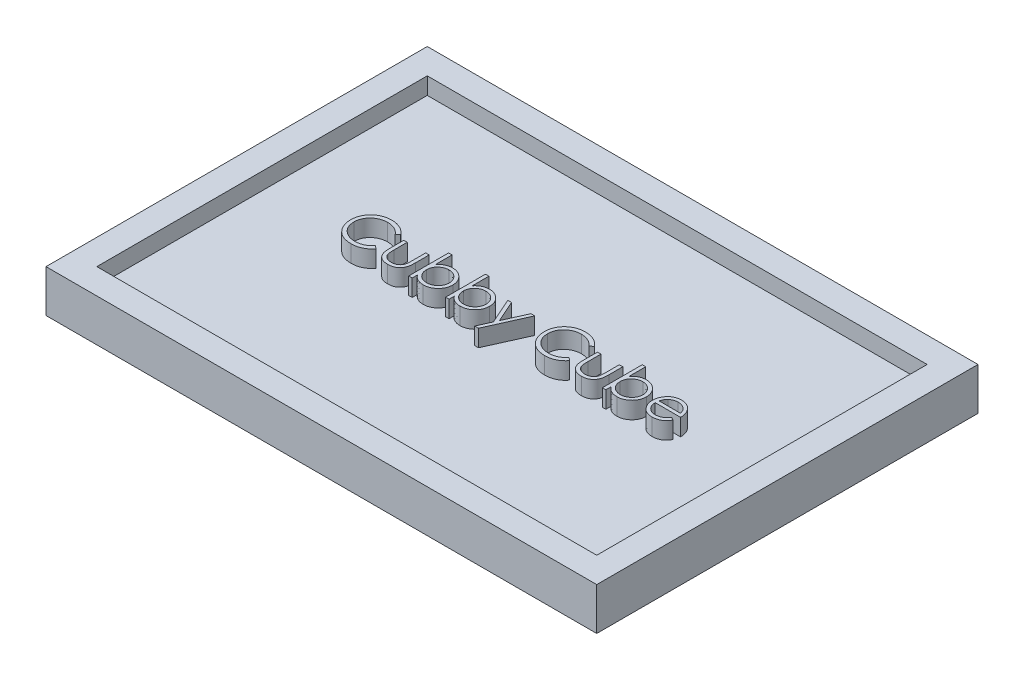
from build123d import *

# Parameters (mm, degrees)
SKETCH1_W           = 82.55
SKETCH1_H           = 57.15
BOSS_EXTRUDE1_DEPTH = 6.35
SHELL1_T            = -3.81
BOSS_EXTRUDE2_DEPTH = 2.54


with BuildPart() as part:
    # Sketch1 → Boss-Extrude1 (new body)
    with BuildSketch(Plane(origin=(0, 0, 0), x_dir=(1, 0, 0), z_dir=(0, 1, 0))):
        with Locations((41.275, 28.575)):
            Rectangle(SKETCH1_W, SKETCH1_H)
    extrude(amount=BOSS_EXTRUDE1_DEPTH)

    # Shell1
    shell1_openings = [part.faces().sort_by_distance(p)[0] for p in [
        (41.275, 6.35, -28.575),
    ]]
    offset(amount=SHELL1_T, openings=shell1_openings, kind=Kind.INTERSECTION)

    # Sketch2 → Boss-Extrude2 (add)
    # profile 1 of 9: a face of its own
    with BuildSketch(Plane(origin=(0, 3.81, 0), x_dir=(1, 0, 0), z_dir=(0, 1, 0))):
        with BuildLine():
            Line((22.421777935, 30.73376706), (21.964693267, 30.383957364))
            add(Edge.make_bspline(
                [(21.964693267, 30.383957364), (21.932086807, 30.422817197), (21.867313494, 30.500012949), (21.763105272, 30.608412739), (21.654502421, 30.709970084), (21.541546454, 30.805168782), (21.422204204, 30.89067976), (21.299366661, 30.970959201), (21.17097896, 31.04291757), (20.993440658, 31.130168513), (20.761192987, 31.221216582), (20.468829427, 31.297558028), (20.163632993, 31.346155626), (19.955417461, 31.351419059), (19.849510641, 31.354096253)],
                knots=[0, 0, 0, 0, 0.757959112, 1.505699292, 2.245454638, 2.979532153, 3.711538275, 4.438200793, 5.171680507, 5.909471876, 7.393775596, 8.890124382, 10.418191784, 12, 12, 12, 12], degree=3))
            add(Edge.make_bspline(
                [(19.849510641, 31.354096253), (19.791163773, 31.353424425), (19.675011551, 31.352087004), (19.502634268, 31.334443018), (19.333475777, 31.309644256), (19.167646112, 31.272847736), (19.005356359, 31.226326606), (18.845545542, 31.17073696), (18.690527438, 31.101959923), (18.538157582, 31.025942733), (18.392172394, 30.940081376), (18.25404394, 30.846426908), (18.124275998, 30.746027351), (18.002765916, 30.638506404), (17.889389473, 30.524348287), (17.784968195, 30.402336399), (17.689863412, 30.27286082), (17.602189978, 30.13762888), (17.523670706, 29.997034481), (17.457928752, 29.850557251), (17.3997119, 29.700705546), (17.353645422, 29.545786294), (17.317182862, 29.386889575), (17.292024117, 29.223588943), (17.274580791, 29.05622555), (17.273250021, 28.942786967), (17.272579217, 28.885605835)],
                knots=[0, 0, 0, 0, 1.054917814, 2.100044995, 3.131103042, 4.146048494, 5.169673617, 6.183595914, 7.203665975, 8.234915748, 9.262203917, 10.264457458, 11.251630812, 12.227803204, 13.197192746, 14.159520551, 15.12972552, 16.100847026, 17.073214652, 18.039054194, 19.002613845, 19.979014051, 20.95965708, 21.949030935, 22.966165397, 24, 24, 24, 24], degree=3))
            add(Edge.make_bspline(
                [(17.272579217, 28.885605835), (17.274677743, 28.799571723), (17.278797918, 28.630655156), (17.315466398, 28.383235462), (17.371188556, 28.146210009), (17.454701843, 27.921060438), (17.557679121, 27.705010466), (17.687800709, 27.501715611), (17.838504641, 27.308103777), (18.011922931, 27.128750684), (18.202190699, 26.964912976), (18.406332166, 26.820638497), (18.623838893, 26.700371961), (18.852309312, 26.600293631), (19.093501552, 26.523364287), (19.346981884, 26.469207048), (19.612199, 26.433879279), (19.79342549, 26.430497062), (19.885657643, 26.42877574)],
                knots=[0, 0, 0, 0, 1.029171465, 2.020641659, 2.987623507, 3.938342917, 4.889210282, 5.84687017, 6.821220943, 7.821438502, 8.827599549, 9.822697543, 10.807740252, 11.797342354, 12.80366471, 13.83203677, 14.896651826, 16, 16, 16, 16], degree=3))
            add(Edge.make_bspline(
                [(19.885657643, 26.42877574), (19.987277234, 26.431584342), (20.187288899, 26.437112341), (20.480605723, 26.483943855), (20.761395681, 26.55987732), (21.029673876, 26.666145651), (21.284683996, 26.804291135), (21.526825108, 26.971761296), (21.756301601, 27.170149154), (21.894290745, 27.321629071), (21.964693267, 27.398914629)],
                knots=[0, 0, 0, 0, 1.028121516, 2.023589091, 2.998037872, 3.967518031, 4.937445131, 5.927275754, 6.942489185, 8, 8, 8, 8], degree=3))
            Line((21.964693267, 27.398914629), (22.421777935, 27.05260303))
            add(Edge.make_bspline(
                [(22.421777935, 27.05260303), (22.384993412, 27.005140867), (22.311600561, 26.910443881), (22.192759074, 26.776944383), (22.067565759, 26.651373981), (21.935090727, 26.534745068), (21.796857923, 26.424723891), (21.65038528, 26.324436203), (21.49759833, 26.232482197), (21.33901475, 26.148284799), (21.174803033, 26.07358314), (21.005159943, 26.009630862), (20.830816712, 25.954541016), (20.65176537, 25.909218449), (20.467634522, 25.873842611), (20.279088627, 25.850193938), (20.085720751, 25.833992206), (19.955265197, 25.832515518), (19.88915574, 25.831767193)],
                knots=[0, 0, 0, 0, 0.986787822, 1.968848986, 2.935600012, 3.899624008, 4.868462664, 5.837806735, 6.815139263, 7.798259679, 8.787526145, 9.778297419, 10.776456485, 11.791383307, 12.812564526, 13.85620153, 14.913611965, 16, 16, 16, 16], degree=3))
            add(Edge.make_bspline(
                [(19.88915574, 25.831767193), (19.826550736, 25.832202912), (19.702757095, 25.833064491), (19.519985004, 25.847021465), (19.342051142, 25.866063468), (19.169464056, 25.894735448), (19.001281928, 25.928570023), (18.839029385, 25.97392472), (18.681109826, 26.024730893), (18.528157717, 26.084444306), (18.380042954, 26.151826576), (18.237243259, 26.2279823), (18.099824306, 26.312271067), (17.966435053, 26.402834936), (17.839045976, 26.502582901), (17.716553149, 26.610129673), (17.598269697, 26.725112769), (17.525089041, 26.808026139), (17.488295196, 26.849713407)],
                knots=[0, 0, 0, 0, 1.114604814, 2.203992996, 3.262667896, 4.300477797, 5.318619304, 6.316056647, 7.298880507, 8.271930387, 9.238335007, 10.195173496, 11.151986948, 12.108099108, 13.064862484, 14.031167946, 15.010108607, 16, 16, 16, 16], degree=3))
            add(Edge.make_bspline(
                [(17.488295196, 26.849713407), (17.429362346, 26.922126551), (17.312208135, 27.066078604), (17.16232054, 27.299387551), (17.034016809, 27.542978132), (16.930279712, 27.798130085), (16.849182642, 28.064270871), (16.793001298, 28.341534649), (16.756493689, 28.629662477), (16.75231884, 28.825636279), (16.750196739, 28.925250934)],
                knots=[0, 0, 0, 0, 0.994628077, 1.977248131, 2.950237994, 3.925870899, 4.908910175, 5.911660606, 6.938484602, 8, 8, 8, 8], degree=3))
            add(Edge.make_bspline(
                [(16.750196739, 28.925250934), (16.752783174, 29.029951849), (16.757871823, 29.235944363), (16.801105307, 29.538251759), (16.870653948, 29.827882121), (16.96943663, 30.104294777), (17.094676601, 30.368943588), (17.24938872, 30.619806878), (17.431775622, 30.858488984), (17.640406874, 31.081368279), (17.869194455, 31.285162892), (18.114199672, 31.464454877), (18.374942982, 31.61366365), (18.648551838, 31.738389411), (18.937075048, 31.834257643), (19.239897033, 31.901368836), (19.556448775, 31.943140992), (19.772422357, 31.948421665), (19.882159546, 31.9511048)],
                knots=[0, 0, 0, 0, 1.032925535, 2.032216505, 3.007276963, 3.968222605, 4.92396291, 5.891752235, 6.871517503, 7.883894988, 8.900124299, 9.891468569, 10.874487609, 11.85992873, 12.854644235, 13.869047385, 14.917252991, 16, 16, 16, 16], degree=3))
            add(Edge.make_bspline(
                [(19.882159546, 31.9511048), (19.949040043, 31.950302958), (20.081423251, 31.948715793), (20.277257126, 31.933238793), (20.467918234, 31.907438188), (20.653537927, 31.872320153), (20.83501923, 31.828734881), (21.010975107, 31.771956314), (21.182438042, 31.707034844), (21.34832665, 31.632264634), (21.507845008, 31.548333636), (21.660943433, 31.456172177), (21.806405823, 31.35589451), (21.945255729, 31.248353491), (22.075170428, 31.131273982), (22.199838506, 31.007876313), (22.315026275, 30.874606132), (22.38612891, 30.780799355), (22.421777935, 30.73376706)],
                knots=[0, 0, 0, 0, 1.096760587, 2.17092713, 3.219439832, 4.250915756, 5.268269357, 6.278326846, 7.281116186, 8.274029601, 9.260640565, 10.235837813, 11.203064059, 12.156899882, 13.114053108, 14.069676657, 15.032185724, 16, 16, 16, 16], degree=3))
        make_face()
    # profile 2 of 9: a face of its own
    with BuildSketch(Plane(origin=(0, 3.81, 0), x_dir=(1, 0, 0), z_dir=(0, 1, 0))):
        with BuildLine():
            Line((23.391916824, 30.234705227), (23.914299303, 30.234705227))
            Line((23.914299303, 30.234705227), (23.914299303, 28.261778545))
            add(Edge.make_bspline(
                [(23.914299303, 28.261778545), (23.914535304, 28.203864996), (23.914986764, 28.093079091), (23.918048424, 27.933662786), (23.925249782, 27.788280468), (23.934253488, 27.656848152), (23.945832183, 27.539388073), (23.959608201, 27.4363105), (23.975005837, 27.346446506), (23.990077994, 27.292323806), (23.997087597, 27.267152977)],
                knots=[0, 0, 0, 0, 1.388932606, 2.656963016, 3.823490214, 4.879454478, 5.816252168, 6.653371382, 7.373723809, 8, 8, 8, 8], degree=3))
            add(Edge.make_bspline(
                [(23.997087597, 27.267152977), (24.008332541, 27.235516131), (24.030588649, 27.172900161), (24.070957764, 27.082446065), (24.120897748, 26.998667173), (24.175546771, 26.9183329), (24.238577095, 26.843822929), (24.309191239, 26.775263085), (24.38502545, 26.710062948), (24.497708507, 26.632920621), (24.651809691, 26.550239293), (24.854129809, 26.478899461), (25.073499099, 26.436264651), (25.225114709, 26.431318182), (25.303043794, 26.42877574)],
                knots=[0, 0, 0, 0, 0.725840625, 1.436591201, 2.137033971, 2.831655856, 3.53531722, 4.242432219, 4.957935707, 5.694543706, 7.190802206, 8.724350549, 10.316345118, 12, 12, 12, 12], degree=3))
            add(Edge.make_bspline(
                [(25.303043794, 26.42877574), (25.38096564, 26.431372245), (25.531729993, 26.436396002), (25.748689031, 26.477613387), (25.947015491, 26.546474992), (26.124718799, 26.642614223), (26.28099294, 26.760265011), (26.411220646, 26.898316565), (26.518668664, 27.052401319), (26.565583617, 27.167361578), (26.589177441, 27.225175814)],
                knots=[0, 0, 0, 0, 1.157059328, 2.238695713, 3.266970494, 4.264342957, 5.228770407, 6.160125903, 7.074715775, 8, 8, 8, 8], degree=3))
            add(Edge.make_bspline(
                [(26.589177441, 27.225175814), (26.596152845, 27.248403098), (26.61157376, 27.299752952), (26.628142099, 27.386865462), (26.643067484, 27.490750049), (26.655812075, 27.612086498), (26.664901161, 27.750557724), (26.669800684, 27.906120453), (26.675335923, 28.078286335), (26.675419936, 28.19880712), (26.675463833, 28.261778545)],
                knots=[0, 0, 0, 0, 0.557542046, 1.232589297, 2.036731608, 2.971723315, 4.038036528, 5.22795436, 6.551621927, 8, 8, 8, 8], degree=3))
            Line((26.675463833, 28.261778545), (26.675463833, 30.234705227))
            Line((26.675463833, 30.234705227), (27.197846311, 30.234705227))
            Line((27.197846311, 30.234705227), (27.197846311, 28.16383183))
            add(Edge.make_bspline(
                [(27.197846311, 28.16383183), (27.197111731, 28.093470975), (27.195686544, 27.95696129), (27.186527307, 27.758580452), (27.170811702, 27.573707052), (27.14695845, 27.402243231), (27.118909227, 27.244319895), (27.082726473, 27.099734643), (27.03952219, 26.968932944), (26.990784327, 26.849619536), (26.933204864, 26.741440356), (26.871958022, 26.638767814), (26.801235276, 26.544149444), (26.726778113, 26.452875223), (26.643953216, 26.369485088), (26.554312618, 26.29206555), (26.459118011, 26.219433139), (26.356256904, 26.154420618), (26.247230928, 26.095851983), (26.13190549, 26.043936672), (26.008868044, 26.002853934), (25.879706019, 25.967412267), (25.743786602, 25.939614513), (25.601240824, 25.92001233), (25.452116702, 25.907995917), (25.35048585, 25.90693645), (25.298379665, 25.906393262)],
                knots=[0, 0, 0, 0, 1.493040784, 2.896703357, 4.213163133, 5.428574705, 6.569057535, 7.615249723, 8.588095153, 9.490268104, 10.346124644, 11.18633936, 12.024365274, 12.850166724, 13.684164916, 14.514361689, 15.362232829, 16.222528818, 17.093394965, 17.986930858, 18.902426812, 19.842810585, 20.827885679, 21.843828298, 22.894529745, 24, 24, 24, 24], degree=3))
            add(Edge.make_bspline(
                [(25.298379665, 25.906393262), (25.2466632, 25.906958227), (25.145035533, 25.908068436), (24.995903714, 25.919945943), (24.852962996, 25.939584055), (24.716721571, 25.967615887), (24.587042722, 26.002605864), (24.463401171, 26.044189125), (24.347244674, 26.095878926), (24.237177698, 26.154049935), (24.134061822, 26.219850756), (24.037421722, 26.291975936), (23.94738698, 26.370317806), (23.863937738, 26.454549184), (23.788245323, 26.54571497), (23.719366501, 26.643081812), (23.656240886, 26.745684957), (23.599108924, 26.855554288), (23.550028064, 26.976248452), (23.506695708, 27.109790172), (23.471254087, 27.257643524), (23.44241191, 27.419682101), (23.419209336, 27.595130402), (23.403100359, 27.78500335), (23.394093317, 27.988838443), (23.392657963, 28.129619272), (23.391916824, 28.202310896)],
                knots=[0, 0, 0, 0, 1.083640291, 2.129454052, 3.13281866, 4.105697902, 5.042300162, 5.946461698, 6.836384745, 7.703652036, 8.553297018, 9.397182691, 10.228592656, 11.052265423, 11.879314572, 12.708807002, 13.549817954, 14.402308542, 15.300838682, 16.27712199, 17.341985831, 18.484375296, 19.725102775, 21.0496083, 22.476576903, 24, 24, 24, 24], degree=3))
            Line((23.391916824, 28.202310896), (23.391916824, 30.234705227))
        make_face()
    # profile 3 of 9: a face of its own
    with BuildSketch(Plane(origin=(0, 3.81, 0), x_dir=(1, 0, 0), z_dir=(0, 1, 0))):
        with BuildLine():
            Line((28.391863405, 25.98101933), (28.391863405, 31.9511048))
            Line((28.391863405, 31.9511048), (28.914245884, 31.9511048))
            Line((28.914245884, 31.9511048), (28.914245884, 29.462791833))
            add(Edge.make_bspline(
                [(28.914245884, 29.462791833), (28.973108511, 29.530576155), (29.087951922, 29.662826162), (29.280499186, 29.835534694), (29.482408211, 29.98197435), (29.695214977, 30.102691978), (29.919222153, 30.194617251), (30.153273052, 30.261843535), (30.397965986, 30.302401277), (30.564806326, 30.30700152), (30.649301974, 30.309331296)],
                knots=[0, 0, 0, 0, 1.077089805, 2.101446609, 3.097517232, 4.067117542, 5.031729543, 5.997785507, 6.985986182, 8, 8, 8, 8], degree=3))
            add(Edge.make_bspline(
                [(30.649301974, 30.309331296), (30.724417562, 30.307268678), (30.872933883, 30.303190532), (31.091268597, 30.272199591), (31.301339603, 30.221944509), (31.503032556, 30.152273825), (31.695406328, 30.05983404), (31.880108117, 29.949169508), (32.056191626, 29.81738862), (32.220929334, 29.666715001), (32.372759762, 29.50313857), (32.505661877, 29.328213688), (32.6179203, 29.144483091), (32.710773057, 28.952561797), (32.78257063, 28.751665961), (32.832034853, 28.541992562), (32.863456483, 28.323747869), (32.867415059, 28.17521217), (32.869427508, 28.099700052)],
                knots=[0, 0, 0, 0, 1.034377878, 2.045141349, 3.03070803, 4.00595497, 4.978199603, 5.965204761, 6.967410914, 8.002051993, 9.036360596, 10.037508045, 11.022711142, 11.997267194, 12.969246472, 13.954813154, 14.960274251, 16, 16, 16, 16], degree=3))
            add(Edge.make_bspline(
                [(32.869427508, 28.099700052), (32.86737119, 28.025359666), (32.863316454, 27.878772131), (32.832347445, 27.663057775), (32.781213479, 27.455439129), (32.708101844, 27.256452682), (32.616190987, 27.065163612), (32.501252354, 26.883752511), (32.368519061, 26.709062691), (32.214963567, 26.546705294), (32.048797813, 26.396638556), (31.870989245, 26.266242135), (31.686016597, 26.153622116), (31.490996873, 26.064387996), (31.288817643, 25.99220813), (31.077312862, 25.942119542), (30.857679137, 25.912893878), (30.708468081, 25.908577203), (30.632977521, 25.906393262)],
                knots=[0, 0, 0, 0, 1.024244038, 2.01964794, 2.996620209, 3.965911562, 4.936179293, 5.91563013, 6.920572822, 7.955171681, 8.990768464, 10.002129126, 10.989675881, 11.969873457, 12.952483066, 13.943799762, 14.959703725, 16, 16, 16, 16], degree=3))
            add(Edge.make_bspline(
                [(30.632977521, 25.906393262), (30.546554591, 25.90878913), (30.377094292, 25.913487011), (30.129205515, 25.952435004), (29.894573461, 26.018728658), (29.670525348, 26.107806959), (29.460264004, 26.228429018), (29.262454488, 26.378035661), (29.078344236, 26.559092077), (28.969882461, 26.697231246), (28.914245884, 26.768091145)],
                knots=[0, 0, 0, 0, 1.035807596, 2.031038093, 2.998900396, 3.954262848, 4.914341711, 5.895762244, 6.92060972, 8, 8, 8, 8], degree=3))
            Line((28.914245884, 26.768091145), (28.914245884, 25.98101933))
            Line((28.914245884, 25.98101933), (28.391863405, 25.98101933))
        make_face()
        with BuildLine():
            add(Edge.make_bspline(
                [(30.628313392, 26.42877574), (30.704673333, 26.431492621), (30.855395711, 26.43685531), (31.076660205, 26.478721443), (31.288395861, 26.548378713), (31.489535725, 26.643646976), (31.676932152, 26.763426479), (31.844327069, 26.90835886), (31.993140347, 27.073839355), (32.117293361, 27.260494676), (32.220947841, 27.459153014), (32.292150397, 27.668128085), (32.339914028, 27.881827156), (32.344657672, 28.026759328), (32.347045029, 28.099700052)],
                knots=[0, 0, 0, 0, 1.031910345, 2.036826888, 3.032245421, 4.038315463, 5.03827337, 6.029480047, 7.023177075, 8.037597977, 9.052889626, 10.043399556, 11.015292101, 12, 12, 12, 12], degree=3))
            add(Edge.make_bspline(
                [(32.347045029, 28.099700052), (32.343905531, 28.172569472), (32.337639069, 28.318017396), (32.293775294, 28.53363714), (32.217176803, 28.742501321), (32.11553171, 28.944031857), (31.989356025, 29.131974591), (31.84133063, 29.300762338), (31.671891484, 29.446382931), (31.484255392, 29.567772371), (31.284384289, 29.66682558), (31.074018319, 29.734754747), (30.857552965, 29.779222899), (30.710542842, 29.784360414), (30.636475618, 29.786948817)],
                knots=[0, 0, 0, 0, 0.984795267, 1.965658976, 2.959410029, 3.983795688, 5.009594896, 6.01088574, 7.009236619, 8.019050059, 9.024672985, 10.014834719, 10.999826153, 12, 12, 12, 12], degree=3))
            add(Edge.make_bspline(
                [(30.636475618, 29.786948817), (30.560858823, 29.784361877), (30.410774828, 29.779227325), (30.189303392, 29.734676622), (29.972995764, 29.666410535), (29.766293762, 29.568402089), (29.573617434, 29.448473862), (29.401299792, 29.30754284), (29.252732904, 29.146588636), (29.130422609, 28.966133153), (29.033289866, 28.771243279), (28.963799513, 28.563336079), (28.92222272, 28.343505968), (28.916937183, 28.192774315), (28.914245884, 28.116024505)],
                knots=[0, 0, 0, 0, 1.016820015, 2.018181405, 3.029022337, 4.06341356, 5.088169224, 6.076823655, 7.05054209, 8.02560866, 9.001194327, 9.972267242, 10.967515442, 12, 12, 12, 12], degree=3))
            add(Edge.make_bspline(
                [(28.914245884, 28.116024505), (28.915841907, 28.057254347), (28.918983386, 27.941576079), (28.942982464, 27.771728003), (28.981159915, 27.609188563), (29.034950226, 27.453780636), (29.105633827, 27.306386426), (29.190801376, 27.165861398), (29.292169769, 27.033473564), (29.40676799, 26.90954749), (29.533100664, 26.796773976), (29.668681374, 26.69902019), (29.810739528, 26.614843971), (29.960900349, 26.547746656), (30.117416388, 26.492986716), (30.281893748, 26.456841427), (30.452646105, 26.431936511), (30.569141099, 26.429840424), (30.628313392, 26.42877574)],
                knots=[0, 0, 0, 0, 1.050331198, 2.067384183, 3.060053655, 4.031335885, 5.001026174, 5.976994447, 6.963687968, 7.976578778, 8.990422448, 9.985569286, 10.960374351, 11.936812464, 12.921228065, 13.919088064, 14.943024695, 16, 16, 16, 16], degree=3))
        make_face(mode=Mode.SUBTRACT)
    # profile 4 of 9: a face of its own
    with BuildSketch(Plane(origin=(0, 3.81, 0), x_dir=(1, 0, 0), z_dir=(0, 1, 0))):
        with BuildLine():
            Line((33.914192465, 25.98101933), (33.914192465, 31.9511048))
            Line((33.914192465, 31.9511048), (34.436574944, 31.9511048))
            Line((34.436574944, 31.9511048), (34.436574944, 29.462791833))
            add(Edge.make_bspline(
                [(34.436574944, 29.462791833), (34.49543757, 29.530576155), (34.610280981, 29.662826162), (34.802828246, 29.835534694), (35.004737271, 29.98197435), (35.217544037, 30.102691978), (35.441551212, 30.194617251), (35.675602112, 30.261843535), (35.920295045, 30.302401277), (36.087135386, 30.30700152), (36.171631034, 30.309331296)],
                knots=[0, 0, 0, 0, 1.077089805, 2.101446609, 3.097517232, 4.067117542, 5.031729543, 5.997785507, 6.985986182, 8, 8, 8, 8], degree=3))
            add(Edge.make_bspline(
                [(36.171631034, 30.309331296), (36.246746622, 30.307268678), (36.395262943, 30.303190532), (36.613597657, 30.272199591), (36.823668663, 30.221944509), (37.025361615, 30.152273825), (37.217735388, 30.05983404), (37.402437177, 29.949169508), (37.578520686, 29.81738862), (37.743258394, 29.666715001), (37.895088822, 29.50313857), (38.027990937, 29.328213688), (38.14024936, 29.144483091), (38.233102117, 28.952561797), (38.304899689, 28.751665961), (38.354363912, 28.541992562), (38.385785543, 28.323747869), (38.389744119, 28.17521217), (38.391756568, 28.099700052)],
                knots=[0, 0, 0, 0, 1.034377878, 2.045141349, 3.03070803, 4.00595497, 4.978199603, 5.965204761, 6.967410914, 8.002051993, 9.036360596, 10.037508045, 11.022711142, 11.997267194, 12.969246472, 13.954813154, 14.960274251, 16, 16, 16, 16], degree=3))
            add(Edge.make_bspline(
                [(38.391756568, 28.099700052), (38.389700249, 28.025359666), (38.385645514, 27.878772131), (38.354676505, 27.663057775), (38.303542538, 27.455439129), (38.230430904, 27.256452682), (38.138520047, 27.065163612), (38.023581414, 26.883752511), (37.890848121, 26.709062691), (37.737292627, 26.546705294), (37.571126873, 26.396638556), (37.393318305, 26.266242135), (37.208345657, 26.153622116), (37.013325933, 26.064387996), (36.811146703, 25.99220813), (36.599641922, 25.942119542), (36.380008196, 25.912893878), (36.23079714, 25.908577203), (36.155306581, 25.906393262)],
                knots=[0, 0, 0, 0, 1.024244038, 2.01964794, 2.996620209, 3.965911562, 4.936179293, 5.91563013, 6.920572822, 7.955171681, 8.990768464, 10.002129126, 10.989675881, 11.969873457, 12.952483066, 13.943799762, 14.959703725, 16, 16, 16, 16], degree=3))
            add(Edge.make_bspline(
                [(36.155306581, 25.906393262), (36.06888365, 25.90878913), (35.899423352, 25.913487011), (35.651534574, 25.952435004), (35.416902521, 26.018728658), (35.192854408, 26.107806959), (34.982593064, 26.228429018), (34.784783548, 26.378035661), (34.600673296, 26.559092077), (34.492211521, 26.697231246), (34.436574944, 26.768091145)],
                knots=[0, 0, 0, 0, 1.035807596, 2.031038093, 2.998900396, 3.954262848, 4.914341711, 5.895762244, 6.92060972, 8, 8, 8, 8], degree=3))
            Line((34.436574944, 26.768091145), (34.436574944, 25.98101933))
            Line((34.436574944, 25.98101933), (33.914192465, 25.98101933))
        make_face()
        with BuildLine():
            add(Edge.make_bspline(
                [(36.150642452, 26.42877574), (36.227002393, 26.431492621), (36.377724771, 26.43685531), (36.598989265, 26.478721443), (36.810724921, 26.548378713), (37.011864785, 26.643646976), (37.199261212, 26.763426479), (37.366656128, 26.90835886), (37.515469407, 27.073839355), (37.63962242, 27.260494676), (37.743276901, 27.459153014), (37.814479457, 27.668128085), (37.862243088, 27.881827156), (37.866986732, 28.026759328), (37.869374089, 28.099700052)],
                knots=[0, 0, 0, 0, 1.031910345, 2.036826888, 3.032245421, 4.038315463, 5.03827337, 6.029480047, 7.023177075, 8.037597977, 9.052889626, 10.043399556, 11.015292101, 12, 12, 12, 12], degree=3))
            add(Edge.make_bspline(
                [(37.869374089, 28.099700052), (37.866234591, 28.172569472), (37.859968129, 28.318017396), (37.816104354, 28.53363714), (37.739505863, 28.742501321), (37.637860769, 28.944031857), (37.511685084, 29.131974591), (37.36365969, 29.300762338), (37.194220544, 29.446382931), (37.006584452, 29.567772371), (36.806713349, 29.66682558), (36.596347379, 29.734754747), (36.379882025, 29.779222899), (36.232871902, 29.784360414), (36.158804678, 29.786948817)],
                knots=[0, 0, 0, 0, 0.984795267, 1.965658976, 2.959410029, 3.983795688, 5.009594896, 6.01088574, 7.009236619, 8.019050059, 9.024672985, 10.014834719, 10.999826153, 12, 12, 12, 12], degree=3))
            add(Edge.make_bspline(
                [(36.158804678, 29.786948817), (36.083187883, 29.784361877), (35.933103888, 29.779227325), (35.711632452, 29.734676622), (35.495324824, 29.666410535), (35.288622821, 29.568402089), (35.095946494, 29.448473862), (34.923628851, 29.30754284), (34.775061963, 29.146588636), (34.652751668, 28.966133153), (34.555618925, 28.771243279), (34.486128573, 28.563336079), (34.44455178, 28.343505968), (34.439266243, 28.192774315), (34.436574944, 28.116024505)],
                knots=[0, 0, 0, 0, 1.016820015, 2.018181405, 3.029022337, 4.06341356, 5.088169224, 6.076823655, 7.05054209, 8.02560866, 9.001194327, 9.972267242, 10.967515442, 12, 12, 12, 12], degree=3))
            add(Edge.make_bspline(
                [(34.436574944, 28.116024505), (34.438170967, 28.057254347), (34.441312446, 27.941576079), (34.465311524, 27.771728003), (34.503488975, 27.609188563), (34.557279286, 27.453780636), (34.627962887, 27.306386426), (34.713130436, 27.165861398), (34.814498829, 27.033473564), (34.92909705, 26.90954749), (35.055429724, 26.796773976), (35.191010434, 26.69902019), (35.333068588, 26.614843971), (35.483229409, 26.547746656), (35.639745448, 26.492986716), (35.804222808, 26.456841427), (35.974975165, 26.431936511), (36.091470158, 26.429840424), (36.150642452, 26.42877574)],
                knots=[0, 0, 0, 0, 1.050331198, 2.067384183, 3.060053655, 4.031335885, 5.001026174, 5.976994447, 6.963687968, 7.976578778, 8.990422448, 9.985569286, 10.960374351, 11.936812464, 12.921228065, 13.919088064, 14.943024695, 16, 16, 16, 16], degree=3))
        make_face(mode=Mode.SUBTRACT)
    # profile 5 of 9: a face of its own
    with BuildSketch(Plane(origin=(0, 3.81, 0), x_dir=(1, 0, 0), z_dir=(0, 1, 0))):
        Polygon((38.988765115, 30.234705227), (39.551958725, 30.234705227), (40.992008638, 26.97681093), (42.454213165, 30.234705227), (43.018572807, 30.234705227), (40.406660414, 24.413871894), (39.842300772, 24.413871894), (40.708662784, 26.343655381), align=None)
    # profile 6 of 9: a face of its own
    with BuildSketch(Plane(origin=(0, 3.81, 0), x_dir=(1, 0, 0), z_dir=(0, 1, 0))):
        with BuildLine():
            Line((51.451318534, 30.73376706), (50.994233865, 30.383957364))
            add(Edge.make_bspline(
                [(50.994233865, 30.383957364), (50.961627405, 30.422817197), (50.896854092, 30.500012949), (50.792645871, 30.608412739), (50.684043019, 30.709970084), (50.571087052, 30.805168782), (50.451744802, 30.89067976), (50.32890726, 30.970959201), (50.200519558, 31.04291757), (50.022981257, 31.130168513), (49.790733585, 31.221216582), (49.498370026, 31.297558028), (49.193173592, 31.346155626), (48.98495806, 31.351419059), (48.879051239, 31.354096253)],
                knots=[0, 0, 0, 0, 0.757959112, 1.505699292, 2.245454638, 2.979532153, 3.711538275, 4.438200793, 5.171680507, 5.909471876, 7.393775596, 8.890124382, 10.418191784, 12, 12, 12, 12], degree=3))
            add(Edge.make_bspline(
                [(48.879051239, 31.354096253), (48.820704371, 31.353424425), (48.704552149, 31.352087004), (48.532174866, 31.334443018), (48.363016375, 31.309644256), (48.197186711, 31.272847736), (48.034896957, 31.226326606), (47.875086141, 31.17073696), (47.720068036, 31.101959923), (47.56769818, 31.025942733), (47.421712993, 30.940081376), (47.283584538, 30.846426908), (47.153816596, 30.746027351), (47.032306514, 30.638506404), (46.918930071, 30.524348287), (46.814508794, 30.402336399), (46.71940401, 30.27286082), (46.631730577, 30.13762888), (46.553211305, 29.997034481), (46.487469351, 29.850557251), (46.429252499, 29.700705546), (46.38318602, 29.545786294), (46.34672346, 29.386889575), (46.321564716, 29.223588943), (46.304121389, 29.05622555), (46.302790619, 28.942786967), (46.302119816, 28.885605835)],
                knots=[0, 0, 0, 0, 1.054917814, 2.100044995, 3.131103042, 4.146048494, 5.169673617, 6.183595914, 7.203665975, 8.234915748, 9.262203917, 10.264457458, 11.251630812, 12.227803204, 13.197192746, 14.159520551, 15.12972552, 16.100847026, 17.073214652, 18.039054194, 19.002613845, 19.979014051, 20.95965708, 21.949030935, 22.966165397, 24, 24, 24, 24], degree=3))
            add(Edge.make_bspline(
                [(46.302119816, 28.885605835), (46.304218341, 28.799571723), (46.308338517, 28.630655156), (46.345006996, 28.383235462), (46.400729154, 28.146210009), (46.484242441, 27.921060438), (46.587219719, 27.705010466), (46.717341307, 27.501715611), (46.868045239, 27.308103777), (47.04146353, 27.128750684), (47.231731297, 26.964912976), (47.435872765, 26.820638497), (47.653379491, 26.700371961), (47.88184991, 26.600293631), (48.12304215, 26.523364287), (48.376522482, 26.469207048), (48.641739598, 26.433879279), (48.822966088, 26.430497062), (48.915198241, 26.42877574)],
                knots=[0, 0, 0, 0, 1.029171465, 2.020641659, 2.987623507, 3.938342917, 4.889210282, 5.84687017, 6.821220943, 7.821438502, 8.827599549, 9.822697543, 10.807740252, 11.797342354, 12.80366471, 13.83203677, 14.896651826, 16, 16, 16, 16], degree=3))
            add(Edge.make_bspline(
                [(48.915198241, 26.42877574), (49.016817832, 26.431584342), (49.216829497, 26.437112341), (49.510146322, 26.483943855), (49.79093628, 26.55987732), (50.059214474, 26.666145651), (50.314224594, 26.804291135), (50.556365706, 26.971761296), (50.785842199, 27.170149154), (50.923831344, 27.321629071), (50.994233865, 27.398914629)],
                knots=[0, 0, 0, 0, 1.028121516, 2.023589091, 2.998037872, 3.967518031, 4.937445131, 5.927275754, 6.942489185, 8, 8, 8, 8], degree=3))
            Line((50.994233865, 27.398914629), (51.451318534, 27.05260303))
            add(Edge.make_bspline(
                [(51.451318534, 27.05260303), (51.41453401, 27.005140867), (51.34114116, 26.910443881), (51.222299672, 26.776944383), (51.097106357, 26.651373981), (50.964631325, 26.534745068), (50.826398522, 26.424723891), (50.679925878, 26.324436203), (50.527138928, 26.232482197), (50.368555348, 26.148284799), (50.204343631, 26.07358314), (50.034700541, 26.009630862), (49.86035731, 25.954541016), (49.681305969, 25.909218449), (49.497175121, 25.873842611), (49.308629225, 25.850193938), (49.115261349, 25.833992206), (48.984805795, 25.832515518), (48.918696338, 25.831767193)],
                knots=[0, 0, 0, 0, 0.986787822, 1.968848986, 2.935600012, 3.899624008, 4.868462664, 5.837806735, 6.815139263, 7.798259679, 8.787526145, 9.778297419, 10.776456485, 11.791383307, 12.812564526, 13.85620153, 14.913611965, 16, 16, 16, 16], degree=3))
            add(Edge.make_bspline(
                [(48.918696338, 25.831767193), (48.856091335, 25.832202912), (48.732297693, 25.833064491), (48.549525602, 25.847021465), (48.37159174, 25.866063468), (48.199004654, 25.894735448), (48.030822526, 25.928570023), (47.868569983, 25.97392472), (47.710650425, 26.024730893), (47.557698315, 26.084444306), (47.409583553, 26.151826576), (47.266783857, 26.2279823), (47.129364904, 26.312271067), (46.995975651, 26.402834936), (46.868586574, 26.502582901), (46.746093747, 26.610129673), (46.627810295, 26.725112769), (46.55462964, 26.808026139), (46.517835795, 26.849713407)],
                knots=[0, 0, 0, 0, 1.114604814, 2.203992996, 3.262667896, 4.300477797, 5.318619304, 6.316056647, 7.298880507, 8.271930387, 9.238335007, 10.195173496, 11.151986948, 12.108099108, 13.064862484, 14.031167946, 15.010108607, 16, 16, 16, 16], degree=3))
            add(Edge.make_bspline(
                [(46.517835795, 26.849713407), (46.458902945, 26.922126551), (46.341748734, 27.066078604), (46.191861139, 27.299387551), (46.063557407, 27.542978132), (45.95982031, 27.798130085), (45.878723241, 28.064270871), (45.822541896, 28.341534649), (45.786034287, 28.629662477), (45.781859438, 28.825636279), (45.779737337, 28.925250934)],
                knots=[0, 0, 0, 0, 0.994628077, 1.977248131, 2.950237994, 3.925870899, 4.908910175, 5.911660606, 6.938484602, 8, 8, 8, 8], degree=3))
            add(Edge.make_bspline(
                [(45.779737337, 28.925250934), (45.782323772, 29.029951849), (45.787412421, 29.235944363), (45.830645905, 29.538251759), (45.900194546, 29.827882121), (45.998977228, 30.104294777), (46.1242172, 30.368943588), (46.278929318, 30.619806878), (46.46131622, 30.858488984), (46.669947473, 31.081368279), (46.898735053, 31.285162892), (47.143740271, 31.464454877), (47.40448358, 31.61366365), (47.678092436, 31.738389411), (47.966615647, 31.834257643), (48.269437631, 31.901368836), (48.585989374, 31.943140992), (48.801962955, 31.948421665), (48.911700144, 31.9511048)],
                knots=[0, 0, 0, 0, 1.032925535, 2.032216505, 3.007276963, 3.968222605, 4.92396291, 5.891752235, 6.871517503, 7.883894988, 8.900124299, 9.891468569, 10.874487609, 11.85992873, 12.854644235, 13.869047385, 14.917252991, 16, 16, 16, 16], degree=3))
            add(Edge.make_bspline(
                [(48.911700144, 31.9511048), (48.978580641, 31.950302958), (49.110963849, 31.948715793), (49.306797724, 31.933238793), (49.497458833, 31.907438188), (49.683078525, 31.872320153), (49.864559829, 31.828734881), (50.040515705, 31.771956314), (50.211978641, 31.707034844), (50.377867249, 31.632264634), (50.537385606, 31.548333636), (50.690484031, 31.456172177), (50.835946421, 31.35589451), (50.974796328, 31.248353491), (51.104711026, 31.131273982), (51.229379104, 31.007876313), (51.344566874, 30.874606132), (51.415669509, 30.780799355), (51.451318534, 30.73376706)],
                knots=[0, 0, 0, 0, 1.096760587, 2.17092713, 3.219439832, 4.250915756, 5.268269357, 6.278326846, 7.281116186, 8.274029601, 9.260640565, 10.235837813, 11.203064059, 12.156899882, 13.114053108, 14.069676657, 15.032185724, 16, 16, 16, 16], degree=3))
        make_face()
    # profile 7 of 9: a face of its own
    with BuildSketch(Plane(origin=(0, 3.81, 0), x_dir=(1, 0, 0), z_dir=(0, 1, 0))):
        with BuildLine():
            Line((52.421457422, 30.234705227), (52.943839901, 30.234705227))
            Line((52.943839901, 30.234705227), (52.943839901, 28.261778545))
            add(Edge.make_bspline(
                [(52.943839901, 28.261778545), (52.944075902, 28.203864996), (52.944527362, 28.093079091), (52.947589022, 27.933662786), (52.95479038, 27.788280468), (52.963794086, 27.656848152), (52.975372781, 27.539388073), (52.989148799, 27.4363105), (53.004546436, 27.346446506), (53.019618592, 27.292323806), (53.026628196, 27.267152977)],
                knots=[0, 0, 0, 0, 1.388932606, 2.656963016, 3.823490214, 4.879454478, 5.816252168, 6.653371382, 7.373723809, 8, 8, 8, 8], degree=3))
            add(Edge.make_bspline(
                [(53.026628196, 27.267152977), (53.037873139, 27.235516131), (53.060129247, 27.172900161), (53.100498362, 27.082446065), (53.150438346, 26.998667173), (53.205087369, 26.9183329), (53.268117693, 26.843822929), (53.338731838, 26.775263085), (53.414566048, 26.710062948), (53.527249105, 26.632920621), (53.681350289, 26.550239293), (53.883670407, 26.478899461), (54.103039697, 26.436264651), (54.254655308, 26.431318182), (54.332584392, 26.42877574)],
                knots=[0, 0, 0, 0, 0.725840625, 1.436591201, 2.137033971, 2.831655856, 3.53531722, 4.242432219, 4.957935707, 5.694543706, 7.190802206, 8.724350549, 10.316345118, 12, 12, 12, 12], degree=3))
            add(Edge.make_bspline(
                [(54.332584392, 26.42877574), (54.410506238, 26.431372245), (54.561270591, 26.436396002), (54.77822963, 26.477613387), (54.976556089, 26.546474992), (55.154259397, 26.642614223), (55.310533539, 26.760265011), (55.440761245, 26.898316565), (55.548209262, 27.052401319), (55.595124215, 27.167361578), (55.618718039, 27.225175814)],
                knots=[0, 0, 0, 0, 1.157059328, 2.238695713, 3.266970494, 4.264342957, 5.228770407, 6.160125903, 7.074715775, 8, 8, 8, 8], degree=3))
            add(Edge.make_bspline(
                [(55.618718039, 27.225175814), (55.625693444, 27.248403098), (55.641114358, 27.299752952), (55.657682698, 27.386865462), (55.672608082, 27.490750049), (55.685352674, 27.612086498), (55.69444176, 27.750557724), (55.699341283, 27.906120453), (55.704876521, 28.078286335), (55.704960535, 28.19880712), (55.705004431, 28.261778545)],
                knots=[0, 0, 0, 0, 0.557542046, 1.232589297, 2.036731608, 2.971723315, 4.038036528, 5.22795436, 6.551621927, 8, 8, 8, 8], degree=3))
            Line((55.705004431, 28.261778545), (55.705004431, 30.234705227))
            Line((55.705004431, 30.234705227), (56.22738691, 30.234705227))
            Line((56.22738691, 30.234705227), (56.22738691, 28.16383183))
            add(Edge.make_bspline(
                [(56.22738691, 28.16383183), (56.226652329, 28.093470975), (56.225227142, 27.95696129), (56.216067906, 27.758580452), (56.2003523, 27.573707052), (56.176499049, 27.402243231), (56.148449826, 27.244319895), (56.112267072, 27.099734643), (56.069062788, 26.968932944), (56.020324926, 26.849619536), (55.962745463, 26.741440356), (55.90149862, 26.638767814), (55.830775875, 26.544149444), (55.756318711, 26.452875223), (55.673493815, 26.369485088), (55.583853216, 26.29206555), (55.488658609, 26.219433139), (55.385797503, 26.154420618), (55.276771527, 26.095851983), (55.161446088, 26.043936672), (55.038408642, 26.002853934), (54.909246617, 25.967412267), (54.7733272, 25.939614513), (54.630781423, 25.92001233), (54.4816573, 25.907995917), (54.380026449, 25.90693645), (54.327920263, 25.906393262)],
                knots=[0, 0, 0, 0, 1.493040784, 2.896703357, 4.213163133, 5.428574705, 6.569057535, 7.615249723, 8.588095153, 9.490268104, 10.346124644, 11.18633936, 12.024365274, 12.850166724, 13.684164916, 14.514361689, 15.362232829, 16.222528818, 17.093394965, 17.986930858, 18.902426812, 19.842810585, 20.827885679, 21.843828298, 22.894529745, 24, 24, 24, 24], degree=3))
            add(Edge.make_bspline(
                [(54.327920263, 25.906393262), (54.276203799, 25.906958227), (54.174576131, 25.908068436), (54.025444312, 25.919945943), (53.882503594, 25.939584055), (53.746262169, 25.967615887), (53.616583321, 26.002605864), (53.492941769, 26.044189125), (53.376785272, 26.095878926), (53.266718297, 26.154049935), (53.16360242, 26.219850756), (53.06696232, 26.291975936), (52.976927579, 26.370317806), (52.893478336, 26.454549184), (52.817785921, 26.54571497), (52.7489071, 26.643081812), (52.685781484, 26.745684957), (52.628649522, 26.855554288), (52.579568662, 26.976248452), (52.536236306, 27.109790172), (52.500794685, 27.257643524), (52.471952509, 27.419682101), (52.448749934, 27.595130402), (52.432640957, 27.78500335), (52.423633915, 27.988838443), (52.422198562, 28.129619272), (52.421457422, 28.202310896)],
                knots=[0, 0, 0, 0, 1.083640291, 2.129454052, 3.13281866, 4.105697902, 5.042300162, 5.946461698, 6.836384745, 7.703652036, 8.553297018, 9.397182691, 10.228592656, 11.052265423, 11.879314572, 12.708807002, 13.549817954, 14.402308542, 15.300838682, 16.27712199, 17.341985831, 18.484375296, 19.725102775, 21.0496083, 22.476576903, 24, 24, 24, 24], degree=3))
            Line((52.421457422, 28.202310896), (52.421457422, 30.234705227))
        make_face()
    # profile 8 of 9: a face of its own
    with BuildSketch(Plane(origin=(0, 3.81, 0), x_dir=(1, 0, 0), z_dir=(0, 1, 0))):
        with BuildLine():
            Line((57.421404004, 25.98101933), (57.421404004, 31.9511048))
            Line((57.421404004, 31.9511048), (57.943786482, 31.9511048))
            Line((57.943786482, 31.9511048), (57.943786482, 29.462791833))
            add(Edge.make_bspline(
                [(57.943786482, 29.462791833), (58.002649109, 29.530576155), (58.11749252, 29.662826162), (58.310039785, 29.835534694), (58.511948809, 29.98197435), (58.724755575, 30.102691978), (58.948762751, 30.194617251), (59.182813651, 30.261843535), (59.427506584, 30.302401277), (59.594346924, 30.30700152), (59.678842572, 30.309331296)],
                knots=[0, 0, 0, 0, 1.077089805, 2.101446609, 3.097517232, 4.067117542, 5.031729543, 5.997785507, 6.985986182, 8, 8, 8, 8], degree=3))
            add(Edge.make_bspline(
                [(59.678842572, 30.309331296), (59.753958161, 30.307268678), (59.902474481, 30.303190532), (60.120809195, 30.272199591), (60.330880202, 30.221944509), (60.532573154, 30.152273825), (60.724946927, 30.05983404), (60.909648716, 29.949169508), (61.085732224, 29.81738862), (61.250469933, 29.666715001), (61.40230036, 29.50313857), (61.535202475, 29.328213688), (61.647460898, 29.144483091), (61.740313655, 28.952561797), (61.812111228, 28.751665961), (61.861575451, 28.541992562), (61.892997081, 28.323747869), (61.896955658, 28.17521217), (61.898968106, 28.099700052)],
                knots=[0, 0, 0, 0, 1.034377878, 2.045141349, 3.03070803, 4.00595497, 4.978199603, 5.965204761, 6.967410914, 8.002051993, 9.036360596, 10.037508045, 11.022711142, 11.997267194, 12.969246472, 13.954813154, 14.960274251, 16, 16, 16, 16], degree=3))
            add(Edge.make_bspline(
                [(61.898968106, 28.099700052), (61.896911788, 28.025359666), (61.892857052, 27.878772131), (61.861888043, 27.663057775), (61.810754077, 27.455439129), (61.737642442, 27.256452682), (61.645731586, 27.065163612), (61.530792952, 26.883752511), (61.398059659, 26.709062691), (61.244504166, 26.546705294), (61.078338412, 26.396638556), (60.900529843, 26.266242135), (60.715557195, 26.153622116), (60.520537472, 26.064387996), (60.318358241, 25.99220813), (60.106853461, 25.942119542), (59.887219735, 25.912893878), (59.738008679, 25.908577203), (59.66251812, 25.906393262)],
                knots=[0, 0, 0, 0, 1.024244038, 2.01964794, 2.996620209, 3.965911562, 4.936179293, 5.91563013, 6.920572822, 7.955171681, 8.990768464, 10.002129126, 10.989675881, 11.969873457, 12.952483066, 13.943799762, 14.959703725, 16, 16, 16, 16], degree=3))
            add(Edge.make_bspline(
                [(59.66251812, 25.906393262), (59.576095189, 25.90878913), (59.40663489, 25.913487011), (59.158746113, 25.952435004), (58.92411406, 26.018728658), (58.700065946, 26.107806959), (58.489804602, 26.228429018), (58.291995086, 26.378035661), (58.107884834, 26.559092077), (57.999423059, 26.697231246), (57.943786482, 26.768091145)],
                knots=[0, 0, 0, 0, 1.035807596, 2.031038093, 2.998900396, 3.954262848, 4.914341711, 5.895762244, 6.92060972, 8, 8, 8, 8], degree=3))
            Line((57.943786482, 26.768091145), (57.943786482, 25.98101933))
            Line((57.943786482, 25.98101933), (57.421404004, 25.98101933))
        make_face()
        with BuildLine():
            add(Edge.make_bspline(
                [(59.65785399, 26.42877574), (59.734213931, 26.431492621), (59.884936309, 26.43685531), (60.106200804, 26.478721443), (60.317936459, 26.548378713), (60.519076323, 26.643646976), (60.706472751, 26.763426479), (60.873867667, 26.90835886), (61.022680946, 27.073839355), (61.146833959, 27.260494676), (61.250488439, 27.459153014), (61.321690995, 27.668128085), (61.369454627, 27.881827156), (61.374198271, 28.026759328), (61.376585628, 28.099700052)],
                knots=[0, 0, 0, 0, 1.031910345, 2.036826888, 3.032245421, 4.038315463, 5.03827337, 6.029480047, 7.023177075, 8.037597977, 9.052889626, 10.043399556, 11.015292101, 12, 12, 12, 12], degree=3))
            add(Edge.make_bspline(
                [(61.376585628, 28.099700052), (61.37344613, 28.172569472), (61.367179668, 28.318017396), (61.323315892, 28.53363714), (61.246717401, 28.742501321), (61.145072308, 28.944031857), (61.018896623, 29.131974591), (60.870871229, 29.300762338), (60.701432082, 29.446382931), (60.513795991, 29.567772371), (60.313924888, 29.66682558), (60.103558917, 29.734754747), (59.887093563, 29.779222899), (59.74008344, 29.784360414), (59.666016217, 29.786948817)],
                knots=[0, 0, 0, 0, 0.984795267, 1.965658976, 2.959410029, 3.983795688, 5.009594896, 6.01088574, 7.009236619, 8.019050059, 9.024672985, 10.014834719, 10.999826153, 12, 12, 12, 12], degree=3))
            add(Edge.make_bspline(
                [(59.666016217, 29.786948817), (59.590399421, 29.784361877), (59.440315427, 29.779227325), (59.21884399, 29.734676622), (59.002536362, 29.666410535), (58.79583436, 29.568402089), (58.603158032, 29.448473862), (58.43084039, 29.30754284), (58.282273502, 29.146588636), (58.159963207, 28.966133153), (58.062830464, 28.771243279), (57.993340112, 28.563336079), (57.951763318, 28.343505968), (57.946477781, 28.192774315), (57.943786482, 28.116024505)],
                knots=[0, 0, 0, 0, 1.016820015, 2.018181405, 3.029022337, 4.06341356, 5.088169224, 6.076823655, 7.05054209, 8.02560866, 9.001194327, 9.972267242, 10.967515442, 12, 12, 12, 12], degree=3))
            add(Edge.make_bspline(
                [(57.943786482, 28.116024505), (57.945382506, 28.057254347), (57.948523985, 27.941576079), (57.972523062, 27.771728003), (58.010700514, 27.609188563), (58.064490825, 27.453780636), (58.135174426, 27.306386426), (58.220341975, 27.165861398), (58.321710368, 27.033473564), (58.436308588, 26.90954749), (58.562641262, 26.796773976), (58.698221972, 26.69902019), (58.840280126, 26.614843971), (58.990440947, 26.547746656), (59.146956986, 26.492986716), (59.311434346, 26.456841427), (59.482186703, 26.431936511), (59.598681697, 26.429840424), (59.65785399, 26.42877574)],
                knots=[0, 0, 0, 0, 1.050331198, 2.067384183, 3.060053655, 4.031335885, 5.001026174, 5.976994447, 6.963687968, 7.976578778, 8.990422448, 9.985569286, 10.960374351, 11.936812464, 12.921228065, 13.919088064, 14.943024695, 16, 16, 16, 16], degree=3))
        make_face(mode=Mode.SUBTRACT)
    # profile 9 of 9: a face of its own
    with BuildSketch(Plane(origin=(0, 3.81, 0), x_dir=(1, 0, 0), z_dir=(0, 1, 0))):
        with BuildLine():
            Line((66.434833825, 27.324288561), (66.898914687, 27.080587806))
            add(Edge.make_bspline(
                [(66.898914687, 27.080587806), (66.861933112, 27.01498979), (66.789981611, 26.887362027), (66.666246081, 26.712018802), (66.536537837, 26.554278017), (66.395001833, 26.418353819), (66.245872617, 26.299855979), (66.088323189, 26.19618224), (65.921533334, 26.107841082), (65.745495161, 26.033413366), (65.558730312, 25.9761871), (65.360786195, 25.935766866), (65.151283601, 25.910781739), (65.00768168, 25.907879404), (64.934150231, 25.906393262)],
                knots=[0, 0, 0, 0, 1.120438281, 2.179929193, 3.190490725, 4.156257408, 5.095198341, 6.022838206, 6.959905092, 7.901321166, 8.864066838, 9.862729781, 10.905609505, 12, 12, 12, 12], degree=3))
            add(Edge.make_bspline(
                [(64.934150231, 25.906393262), (64.852422442, 25.908301123), (64.692995203, 25.912022809), (64.460927314, 25.944108015), (64.242430829, 25.996449545), (64.037518032, 26.069568427), (63.846690738, 26.165075537), (63.669569673, 26.281424818), (63.50522339, 26.418018579), (63.358830747, 26.576039974), (63.227040623, 26.745146753), (63.110747325, 26.92136148), (63.01352705, 27.104240795), (62.93444253, 27.292620464), (62.870571582, 27.485313154), (62.826056005, 27.684072106), (62.800394864, 27.888359382), (62.796462566, 28.026558165), (62.794480927, 28.096201955)],
                knots=[0, 0, 0, 0, 1.145258523, 2.234067595, 3.276747158, 4.290159414, 5.277019952, 6.260822364, 7.254936242, 8.264827045, 9.274100331, 10.257902744, 11.220704747, 12.172965371, 13.118907548, 14.062713208, 15.023725156, 16, 16, 16, 16], degree=3))
            add(Edge.make_bspline(
                [(62.794480927, 28.096201955), (62.79624238, 28.161553001), (62.799733347, 28.291070143), (62.821737406, 28.482767721), (62.860734151, 28.669081707), (62.914246442, 28.850166914), (62.983350122, 29.025720144), (63.067888943, 29.19584824), (63.1679946, 29.360370169), (63.245283083, 29.464152523), (63.2842145, 29.516429319)],
                knots=[0, 0, 0, 0, 1.024358464, 2.0301432, 3.019427413, 4.004406732, 4.986367066, 5.972626655, 6.978780325, 8, 8, 8, 8], degree=3))
            add(Edge.make_bspline(
                [(63.2842145, 29.516429319), (63.336947397, 29.579408857), (63.440742745, 29.7033729), (63.616293017, 29.866253663), (63.806385129, 30.002700275), (64.008636845, 30.115802619), (64.225398815, 30.201740815), (64.453757243, 30.265782592), (64.696312343, 30.301668879), (64.862131621, 30.306737717), (64.946976586, 30.309331296)],
                knots=[0, 0, 0, 0, 1.030682036, 2.02871468, 2.997146059, 3.962720338, 4.930598197, 5.918074684, 6.934738563, 8, 8, 8, 8], degree=3))
            add(Edge.make_bspline(
                [(64.946976586, 30.309331296), (65.034201949, 30.307079383), (65.205318227, 30.302661645), (65.454835933, 30.261705707), (65.690930125, 30.19675759), (65.913506326, 30.105031583), (66.122587101, 29.986686471), (66.316813424, 29.840098195), (66.499506951, 29.669767161), (66.605793005, 29.538776443), (66.659878062, 29.472120091)],
                knots=[0, 0, 0, 0, 1.056321875, 2.072262726, 3.055038591, 4.01806755, 4.982017516, 5.957941055, 6.960871419, 8, 8, 8, 8], degree=3))
            add(Edge.make_bspline(
                [(66.659878062, 29.472120091), (66.696677268, 29.421888659), (66.770030733, 29.321760149), (66.861911922, 29.158492166), (66.941669637, 28.987674665), (67.005421002, 28.806546469), (67.057042649, 28.617253667), (67.094390477, 28.41844303), (67.116292807, 28.210173761), (67.120598057, 28.068267573), (67.122792893, 27.995923176)],
                knots=[0, 0, 0, 0, 0.94817472, 1.890038105, 2.849395472, 3.817997239, 4.812318967, 5.836947057, 6.897266129, 8, 8, 8, 8], degree=3))
            Line((67.122792893, 27.995923176), (63.316863405, 27.995923176))
            add(Edge.make_bspline(
                [(63.316863405, 27.995923176), (63.319423918, 27.939876094), (63.324459061, 27.829661769), (63.347933889, 27.668390121), (63.384935718, 27.514764456), (63.436939148, 27.369937063), (63.499915318, 27.232016363), (63.577059182, 27.102025452), (63.669094131, 26.980556418), (63.771749848, 26.866522738), (63.886016291, 26.764972877), (64.006229383, 26.674081768), (64.134110705, 26.597902698), (64.268651923, 26.536069001), (64.409635475, 26.487662425), (64.55710578, 26.454620347), (64.710772648, 26.432489361), (64.815523922, 26.430028537), (64.868852421, 26.42877574)],
                knots=[0, 0, 0, 0, 1.094153842, 2.151609401, 3.174256925, 4.172055639, 5.149267565, 6.128595816, 7.11444997, 8.118368179, 9.117203808, 10.09244225, 11.054858984, 12.015122123, 12.976791628, 13.957293641, 14.960065497, 16, 16, 16, 16], degree=3))
            add(Edge.make_bspline(
                [(64.868852421, 26.42877574), (64.920992365, 26.429786996), (65.024448017, 26.431793522), (65.178518586, 26.451304808), (65.3300923, 26.482854183), (65.478541816, 26.525911702), (65.620854282, 26.578427014), (65.752647179, 26.641795695), (65.873853919, 26.711894738), (65.987138921, 26.792072019), (66.097021276, 26.890208254), (66.206024673, 27.012671471), (66.322901441, 27.157506324), (66.396060323, 27.266515009), (66.434833825, 27.324288561)],
                knots=[0, 0, 0, 0, 0.99110716, 1.966546729, 2.947904876, 3.932708344, 4.903319531, 5.828989031, 6.710028674, 7.56322171, 8.463672341, 9.504779593, 10.677557249, 12, 12, 12, 12], degree=3))
        make_face()
        with BuildLine():
            add(Edge.make_bspline(
                [(66.600410414, 28.518305655), (66.581290432, 28.587594982), (66.544490623, 28.720954632), (66.467595145, 28.905626208), (66.380995214, 29.069753586), (66.278512406, 29.212080666), (66.162397216, 29.338481747), (66.028276596, 29.448942179), (65.877873093, 29.547759059), (65.711964141, 29.631167442), (65.536271791, 29.702164743), (65.35232316, 29.749771037), (65.16462991, 29.782383573), (65.037678722, 29.785420565), (64.97379533, 29.786948817)],
                knots=[0, 0, 0, 0, 1.154881502, 2.222775134, 3.210006277, 4.132804581, 5.035138423, 5.962687519, 6.919655026, 7.923214229, 8.944639381, 9.960483929, 10.97369054, 12, 12, 12, 12], degree=3))
            add(Edge.make_bspline(
                [(64.97379533, 29.786948817), (64.921658228, 29.785931549), (64.818594139, 29.783920624), (64.666751767, 29.764844707), (64.520932077, 29.733312679), (64.380059117, 29.690130483), (64.245978934, 29.632573081), (64.115933588, 29.56507931), (63.993229762, 29.482686938), (63.916492393, 29.419890366), (63.877724951, 29.388165764)],
                knots=[0, 0, 0, 0, 1.04873581, 2.073130211, 3.073294108, 4.04793562, 5.032784715, 6.005352987, 6.992311501, 8, 8, 8, 8], degree=3))
            add(Edge.make_bspline(
                [(63.877724951, 29.388165764), (63.849962433, 29.36306248), (63.793777863, 29.31225955), (63.718704877, 29.224732167), (63.646825114, 29.130348915), (63.581409504, 29.025498868), (63.521409042, 28.911375977), (63.465262984, 28.788942839), (63.414727487, 28.657270383), (63.386295028, 28.565513362), (63.371666924, 28.518305655)],
                knots=[0, 0, 0, 0, 0.879870761, 1.780643979, 2.707998968, 3.669668524, 4.684282772, 5.740141944, 6.837334558, 8, 8, 8, 8], degree=3))
            Line((63.371666924, 28.518305655), (66.600410414, 28.518305655))
        make_face(mode=Mode.SUBTRACT)
    extrude(amount=BOSS_EXTRUDE2_DEPTH)


solid = part.part
